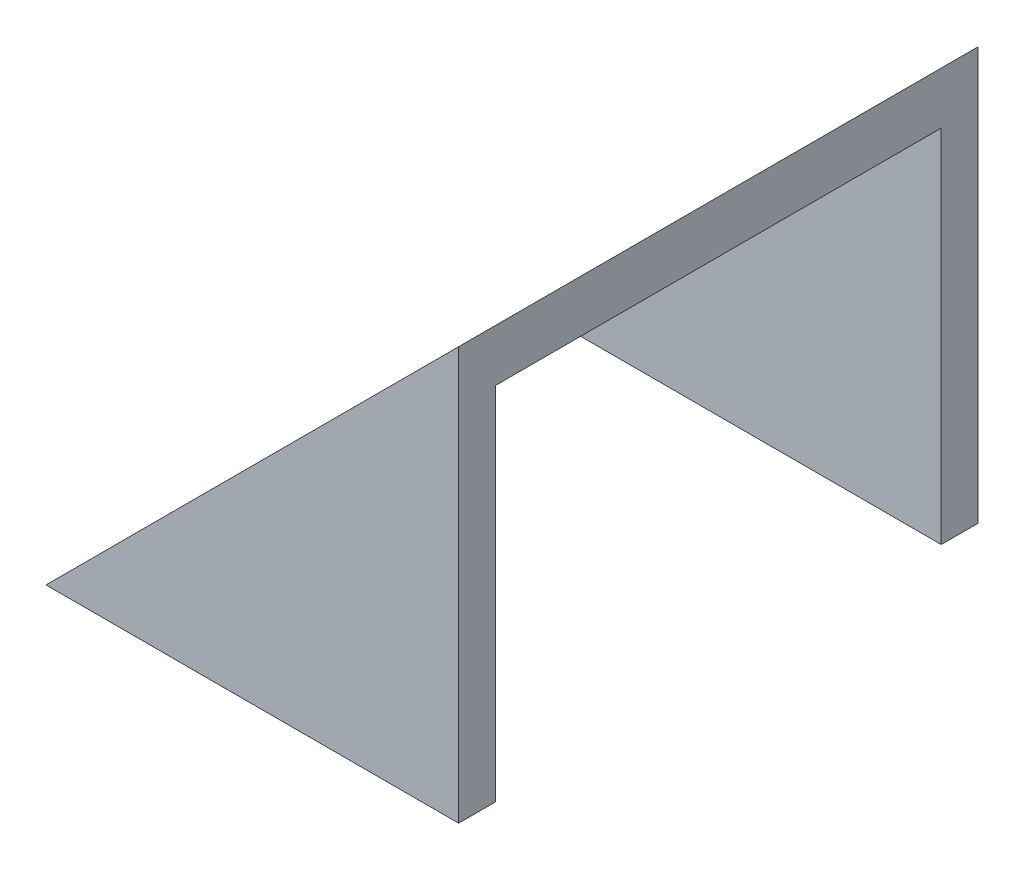
from build123d import *

# Parameters (mm, degrees)
BOSS_EXTRUDE1_DEPTH              = 22.606
CUT_EXTRUDE1_REACH               = 37.603
CUT_EXTRUDE1_OFFSET_FROM_SURFACE = 1.6
SKETCH2_W                        = 19.406
SKETCH2_H                        = 16.360512242


with BuildPart() as part:
    # Sketch1 → Boss-Extrude1 (new body)
    with BuildSketch(Plane.XY):
        Polygon((0, 0), (17.960512242, 17.960512242), (17.960512242, 0), align=None)
    extrude(amount=BOSS_EXTRUDE1_DEPTH)

    # Cut-Extrude1: up to this face of the body (flat: up to its plane, moved by the offset)
    cut_extrude1_end = Plane(part.part.faces().sort_by_distance((8.980256121, 8.980256121, 11.303))[0]).offset(-CUT_EXTRUDE1_OFFSET_FROM_SURFACE)
    # Sketch2 → Cut-Extrude1 (cut, up to the picked face)
    with BuildSketch(Plane(origin=(17.960512242, 0, 0), x_dir=(0, 0, -1), z_dir=(1, 0, 0)), mode=Mode.PRIVATE) as cut_extrude1_sk1:
        with Locations((-11.303, 8.180256121)):
            Rectangle(SKETCH2_W, SKETCH2_H)
    cut_extrude1_tool1 = split(extrude(cut_extrude1_sk1.sketch, amount=-CUT_EXTRUDE1_REACH, mode=Mode.PRIVATE), bisect_by=cut_extrude1_end, keep=Keep.BOTH, mode=Mode.PRIVATE)
    add(cut_extrude1_tool1.solids().sort_by(Axis((17.960512, 8.180256, 11.303), (-1, 0, 0)))[0], mode=Mode.SUBTRACT)


solid = part.part
